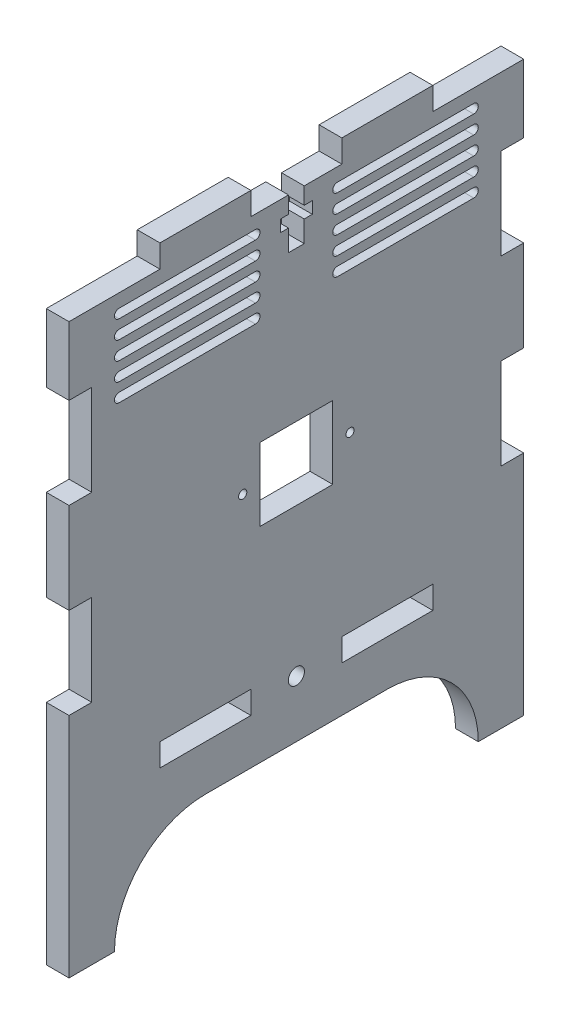
from build123d import *

# Parameters (mm, degrees)
SKETCH1_W                 = 127
SKETCH1_H                 = 165.1
BOSS_EXTRUDE1_DEPTH       = 6.35
SKETCH2_W                 = 25.4
SKETCH2_H                 = 6.35
CUT_EXTRUDE1_DEPTH        = 6.35
LPATTERN1_COUNT           = 3
LPATTERN1_PITCH           = 50.8
CUT_EXTRUDE4_DEPTH        = 6.35
SKETCH8_W                 = 6.35
SKETCH8_H                 = 25.4
CUT_EXTRUDE6_DEPTH        = 6.35
LPATTERN4_COUNT           = 2
LPATTERN4_PITCH           = 50.8
MIRROR1_COPY_1_SKETCH_W   = 6.35
MIRROR1_COPY_1_SKETCH_H   = 25.4
MIRROR1_COPY_1_DEPTH      = 6.35
MIRROR1_COPY_2_SKETCH_W   = 6.35
MIRROR1_COPY_2_SKETCH_H   = 25.4
MIRROR1_COPY_2_DEPTH      = 6.35
SKETCH9_W                 = 25.4
SKETCH9_H                 = 6.35
CUT_EXTRUDE7_DEPTH        = 6.35
LPATTERN6_COUNT           = 2
LPATTERN6_PITCH           = 50.8
SKETCH16_W                = 4.3942
SKETCH16_H                = 13.97
SKETCH16_W_2              = 8.89
SKETCH16_H_2              = 3.302
CUT_EXTRUDE14_DEPTH       = 6.35
F_8_CLEARANCE_HOLE1_D     = 4.4958
F_8_CLEARANCE_HOLE1_DEPTH = 10.16
F_8_CLEARANCE_HOLE1_TIP   = 1.350674586
CUT_EXTRUDE15_DEPTH       = 6.35
LPATTERN7_COPY_1_DEPTH    = 6.35
LPATTERN7_COPY_2_DEPTH    = 6.35
LPATTERN7_COPY_3_DEPTH    = 6.35
LPATTERN7_COPY_4_DEPTH    = 6.35
LPATTERN7_COPY_5_DEPTH    = 6.35
LPATTERN7_COPY_6_DEPTH    = 6.35
LPATTERN7_COPY_7_DEPTH    = 6.35
LPATTERN7_COPY_8_DEPTH    = 6.35
SKETCH20_R                = 1.143
SKETCH20_W                = 20.32
SKETCH20_H                = 20.32
CUT_EXTRUDE16_DEPTH       = 10.16


with BuildPart() as part:
    # Sketch1 → Boss-Extrude1 (new body)
    with BuildSketch(Plane(origin=(0, 0, 0), x_dir=(0, 0, -1), z_dir=(1, 0, 0))):
        Rectangle(SKETCH1_W, SKETCH1_H)
    extrude(amount=BOSS_EXTRUDE1_DEPTH)

    # Sketch2 → Cut-Extrude1 (cut)
    with BuildSketch(Plane(origin=(6.35, 0, 0), x_dir=(0, 0, -1), z_dir=(1, 0, 0))):
        with Locations((-50.8, 79.375)):
            Rectangle(SKETCH2_W, SKETCH2_H)
    cut_extrude1 = extrude(amount=-CUT_EXTRUDE1_DEPTH, mode=Mode.SUBTRACT)

    # LPattern1: Cut-Extrude1 ×3
    with Locations(*[(0, 0, -i * LPATTERN1_PITCH) for i in range(1, LPATTERN1_COUNT)]):
        add(cut_extrude1, mode=Mode.SUBTRACT)

    # Sketch5 → Cut-Extrude4 (cut)
    with BuildSketch(Plane(origin=(6.35, 0, 0), x_dir=(0, 0, -1), z_dir=(1, 0, 0))):
        with BuildLine():
            Line((-25.4, -57.15), (25.4, -57.15))
            ThreePointArc((25.4, -57.15), (50.8, -82.55), (25.4, -107.95))
            Line((25.4, -107.95), (-25.4, -107.95))
            ThreePointArc((-25.4, -107.95), (-50.8, -82.55), (-25.4, -57.15))
        make_face()
    extrude(amount=-CUT_EXTRUDE4_DEPTH, mode=Mode.SUBTRACT)

    # Sketch8 → Cut-Extrude6 (cut)
    with BuildSketch(Plane(origin=(6.35, 0, 0), x_dir=(0, 0, -1), z_dir=(1, 0, 0))):
        with Locations((60.325, 44.45)):
            Rectangle(SKETCH8_W, SKETCH8_H)
    cut_extrude6 = extrude(amount=-CUT_EXTRUDE6_DEPTH, mode=Mode.SUBTRACT)

    # LPattern4: Cut-Extrude6 ×2
    with Locations(*[(0, -i * LPATTERN4_PITCH, 0) for i in range(1, LPATTERN4_COUNT)]):
        add(cut_extrude6, mode=Mode.SUBTRACT)

    # Mirror1 copy 1 sketch → Mirror1 copy 1 (cut)
    with BuildSketch(Plane(origin=(6.35, -50.8, 0), x_dir=(0, 0, 1), z_dir=(1, 0, 0))):
        with Locations((60.325, -44.45)):
            Rectangle(MIRROR1_COPY_1_SKETCH_W, MIRROR1_COPY_1_SKETCH_H)
    extrude(amount=-MIRROR1_COPY_1_DEPTH, mode=Mode.SUBTRACT)

    # Mirror1 copy 2 sketch → Mirror1 copy 2 (cut)
    with BuildSketch(Plane(origin=(6.35, 0, 0), x_dir=(0, 0, 1), z_dir=(1, 0, 0))):
        with Locations((60.325, -44.45)):
            Rectangle(MIRROR1_COPY_2_SKETCH_W, MIRROR1_COPY_2_SKETCH_H)
    extrude(amount=-MIRROR1_COPY_2_DEPTH, mode=Mode.SUBTRACT)

    # Sketch9 → Cut-Extrude7 (cut)
    with BuildSketch(Plane.ZY):
        with Locations((-25.4, -41.275)):
            Rectangle(SKETCH9_W, SKETCH9_H)
    cut_extrude7 = extrude(amount=-CUT_EXTRUDE7_DEPTH, mode=Mode.SUBTRACT)

    # LPattern6: Cut-Extrude7 ×2
    with Locations(*[(0, 0, i * LPATTERN6_PITCH) for i in range(1, LPATTERN6_COUNT)]):
        add(cut_extrude7, mode=Mode.SUBTRACT)

    # Sketch16 → Cut-Extrude14 (cut)
    with BuildSketch(Plane.ZY):
        with Locations((0, 69.215)):
            Rectangle(SKETCH16_W, SKETCH16_H)
        with Locations((0, 69.85)):
            Rectangle(SKETCH16_W_2, SKETCH16_H_2)
    extrude(amount=-CUT_EXTRUDE14_DEPTH, mode=Mode.SUBTRACT)

    # #8 Clearance Hole1
    with Locations(Plane.ZY):
        with Locations((0, -41.275)):
            Hole(F_8_CLEARANCE_HOLE1_D / 2, depth=F_8_CLEARANCE_HOLE1_DEPTH)
            with Locations((0, 0, -(F_8_CLEARANCE_HOLE1_DEPTH + F_8_CLEARANCE_HOLE1_TIP / 2))):  # 118° drill point
                Cone(0, F_8_CLEARANCE_HOLE1_D / 2, F_8_CLEARANCE_HOLE1_TIP, mode=Mode.SUBTRACT)

    # Sketch19 → Cut-Extrude15 (cut)
    with BuildSketch(Plane.ZY):
        with BuildLine():
            Line((-49.53, 72.448860523), (-11.43, 72.448860523))
            ThreePointArc((-11.43, 72.448860523), (-10.16, 71.178860523), (-11.43, 69.908860523))
            Line((-11.43, 69.908860523), (-49.53, 69.908860523))
            ThreePointArc((-49.53, 69.908860523), (-50.8, 71.178860523), (-49.53, 72.448860523))
        make_face()
    cut_extrude15 = extrude(amount=-CUT_EXTRUDE15_DEPTH, mode=Mode.SUBTRACT)

    # Mirror2: Cut-Extrude15 across plane
    add(cut_extrude15.mirror(Plane.XY), mode=Mode.SUBTRACT)

    # LPattern7 copy 1 sketch → LPattern7 copy 1 (cut)
    with BuildSketch(Plane(origin=(0, -5.08, 0), x_dir=(0, 0, -1), z_dir=(-1, 0, 0))):
        with BuildLine():
            Line((-49.53, -72.448860523), (-11.43, -72.448860523))
            ThreePointArc((-11.43, -72.448860523), (-10.16, -71.178860523), (-11.43, -69.908860523))
            Line((-11.43, -69.908860523), (-49.53, -69.908860523))
            ThreePointArc((-49.53, -69.908860523), (-50.8, -71.178860523), (-49.53, -72.448860523))
        make_face()
    extrude(amount=-LPATTERN7_COPY_1_DEPTH, mode=Mode.SUBTRACT)

    # LPattern7 copy 2 sketch → LPattern7 copy 2 (cut)
    with BuildSketch(Plane(origin=(0, -10.16, 0), x_dir=(0, 0, -1), z_dir=(-1, 0, 0))):
        with BuildLine():
            Line((-49.53, -72.448860523), (-11.43, -72.448860523))
            ThreePointArc((-11.43, -72.448860523), (-10.16, -71.178860523), (-11.43, -69.908860523))
            Line((-11.43, -69.908860523), (-49.53, -69.908860523))
            ThreePointArc((-49.53, -69.908860523), (-50.8, -71.178860523), (-49.53, -72.448860523))
        make_face()
    extrude(amount=-LPATTERN7_COPY_2_DEPTH, mode=Mode.SUBTRACT)

    # LPattern7 copy 3 sketch → LPattern7 copy 3 (cut)
    with BuildSketch(Plane(origin=(0, -15.24, 0), x_dir=(0, 0, -1), z_dir=(-1, 0, 0))):
        with BuildLine():
            Line((-49.53, -72.448860523), (-11.43, -72.448860523))
            ThreePointArc((-11.43, -72.448860523), (-10.16, -71.178860523), (-11.43, -69.908860523))
            Line((-11.43, -69.908860523), (-49.53, -69.908860523))
            ThreePointArc((-49.53, -69.908860523), (-50.8, -71.178860523), (-49.53, -72.448860523))
        make_face()
    extrude(amount=-LPATTERN7_COPY_3_DEPTH, mode=Mode.SUBTRACT)

    # LPattern7 copy 4 sketch → LPattern7 copy 4 (cut)
    with BuildSketch(Plane(origin=(0, -20.32, 0), x_dir=(0, 0, -1), z_dir=(-1, 0, 0))):
        with BuildLine():
            Line((-49.53, -72.448860523), (-11.43, -72.448860523))
            ThreePointArc((-11.43, -72.448860523), (-10.16, -71.178860523), (-11.43, -69.908860523))
            Line((-11.43, -69.908860523), (-49.53, -69.908860523))
            ThreePointArc((-49.53, -69.908860523), (-50.8, -71.178860523), (-49.53, -72.448860523))
        make_face()
    extrude(amount=-LPATTERN7_COPY_4_DEPTH, mode=Mode.SUBTRACT)

    # LPattern7 copy 5 sketch → LPattern7 copy 5 (cut)
    with BuildSketch(Plane(origin=(0, -5.08, 0), x_dir=(0, 0, 1), z_dir=(-1, 0, 0))):
        with BuildLine():
            Line((-49.53, 72.448860523), (-11.43, 72.448860523))
            ThreePointArc((-11.43, 72.448860523), (-10.16, 71.178860523), (-11.43, 69.908860523))
            Line((-11.43, 69.908860523), (-49.53, 69.908860523))
            ThreePointArc((-49.53, 69.908860523), (-50.8, 71.178860523), (-49.53, 72.448860523))
        make_face()
    extrude(amount=-LPATTERN7_COPY_5_DEPTH, mode=Mode.SUBTRACT)

    # LPattern7 copy 6 sketch → LPattern7 copy 6 (cut)
    with BuildSketch(Plane(origin=(0, -10.16, 0), x_dir=(0, 0, 1), z_dir=(-1, 0, 0))):
        with BuildLine():
            Line((-49.53, 72.448860523), (-11.43, 72.448860523))
            ThreePointArc((-11.43, 72.448860523), (-10.16, 71.178860523), (-11.43, 69.908860523))
            Line((-11.43, 69.908860523), (-49.53, 69.908860523))
            ThreePointArc((-49.53, 69.908860523), (-50.8, 71.178860523), (-49.53, 72.448860523))
        make_face()
    extrude(amount=-LPATTERN7_COPY_6_DEPTH, mode=Mode.SUBTRACT)

    # LPattern7 copy 7 sketch → LPattern7 copy 7 (cut)
    with BuildSketch(Plane(origin=(0, -15.24, 0), x_dir=(0, 0, 1), z_dir=(-1, 0, 0))):
        with BuildLine():
            Line((-49.53, 72.448860523), (-11.43, 72.448860523))
            ThreePointArc((-11.43, 72.448860523), (-10.16, 71.178860523), (-11.43, 69.908860523))
            Line((-11.43, 69.908860523), (-49.53, 69.908860523))
            ThreePointArc((-49.53, 69.908860523), (-50.8, 71.178860523), (-49.53, 72.448860523))
        make_face()
    extrude(amount=-LPATTERN7_COPY_7_DEPTH, mode=Mode.SUBTRACT)

    # LPattern7 copy 8 sketch → LPattern7 copy 8 (cut)
    with BuildSketch(Plane(origin=(0, -20.32, 0), x_dir=(0, 0, 1), z_dir=(-1, 0, 0))):
        with BuildLine():
            Line((-49.53, 72.448860523), (-11.43, 72.448860523))
            ThreePointArc((-11.43, 72.448860523), (-10.16, 71.178860523), (-11.43, 69.908860523))
            Line((-11.43, 69.908860523), (-49.53, 69.908860523))
            ThreePointArc((-49.53, 69.908860523), (-50.8, 71.178860523), (-49.53, 72.448860523))
        make_face()
    extrude(amount=-LPATTERN7_COPY_8_DEPTH, mode=Mode.SUBTRACT)

    # Sketch20 → Cut-Extrude16 (cut)
    with BuildSketch(Plane.ZY):
        with Locations((-14.986, 10.16)):
            Circle(SKETCH20_R)
        with Locations((14.986, 10.16)):
            Circle(SKETCH20_R)
        with Locations((0, 10.16)):
            Rectangle(SKETCH20_W, SKETCH20_H)
    extrude(amount=-CUT_EXTRUDE16_DEPTH, mode=Mode.SUBTRACT)


solid = part.part
